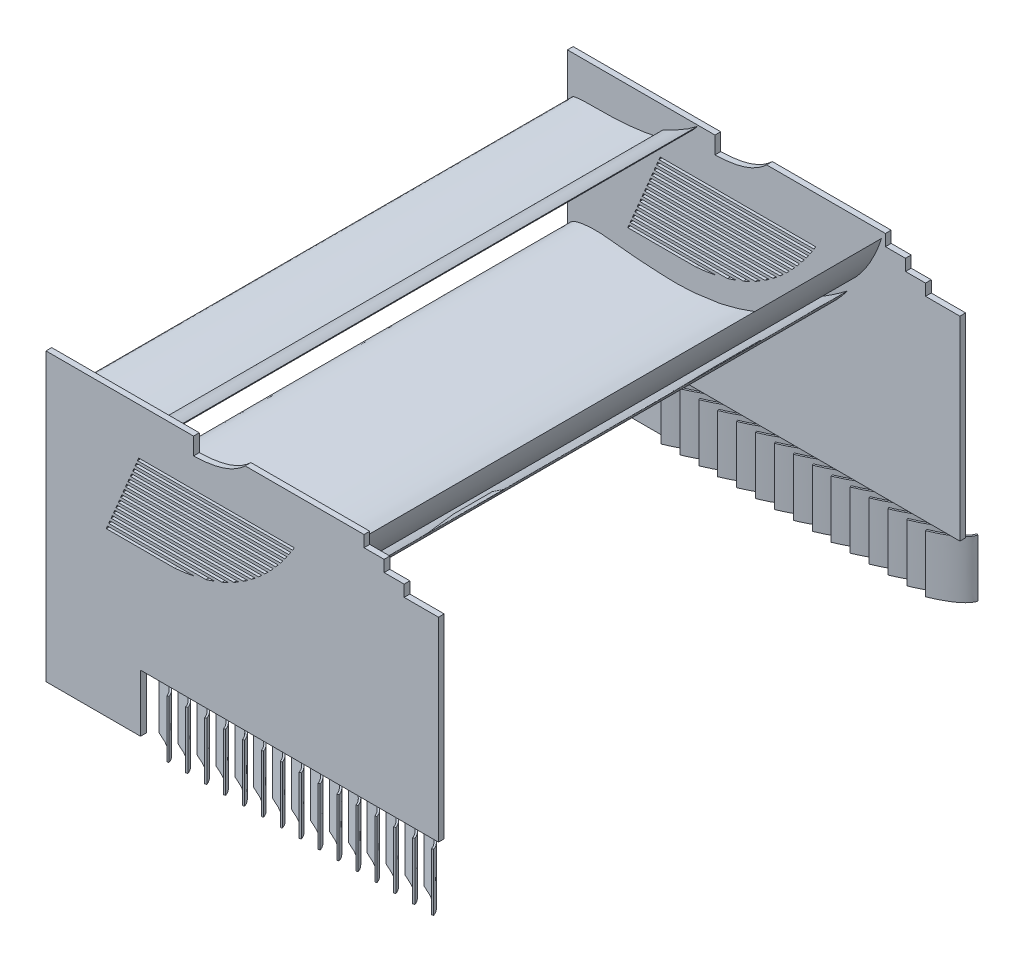
from build123d import *

# Parameters (mm, degrees)
BOSS_EXTRUDE1_DEPTH   = 900
BOSS_EXTRUDE1_2_DEPTH = 900
BOSS_EXTRUDE1_3_DEPTH = 900
BOSS_EXTRUDE2_DEPTH   = 10
BOSS_EXTRUDE3_DEPTH   = 900
CUT_EXTRUDE1_DEPTH    = 900
CUT_EXTRUDE2_DEPTH    = 900
BOSS_EXTRUDE5_DEPTH   = 100


with BuildPart() as part:
    # Sketch2 → Boss-Extrude1 (new body)
    with BuildSketch(Plane.XY):
        with BuildLine():
            add(Edge.make_bspline(
                [(0, 0), (-0.65975565, -5.699703464), (8.017548516, -15.480562025), (19.551157506, -21.724015646), (30.016745353, -25.302215165), (39.859962541, -28.8642232), (50.040399275, -30.662933418), (60.070603806, -32.257702331), (70.013877162, -34.217674322), (80.100972933, -34.55999195), (90.093066457, -35.36519438), (100.111969814, -35.952943269), (110.128217778, -35.507216678), (120.153157744, -35.210003546), (130.150331683, -34.229800116), (140.189993261, -33.410162922), (150.178235204, -31.913406007), (160.170449627, -30.371338734), (170.240789754, -29.163640841), (180.208316099, -27.151030087), (190.263801281, -25.306120223), (200.239152099, -22.872450662), (210.244577583, -20.429111012), (220.232934245, -17.895088966), (230.381125348, -15.705438437), (240.351948949, -12.391144832), (253.551193017, -7.369638816), (266.947574476, -2.806549313), (280.436865809, 1.636643436), (290.361357742, 5.819516769), (300.440735094, 10.032227759), (310.304777653, 14.884053202), (323.821431636, 20.884190166), (337.30228202, 27.249833417), (350.274680503, 34.850235797), (364.037447664, 41.200679435), (378.073354269, 50.431878374), (389.268655411, 56.991671546), (404.933124868, 70.670428585), (388.893146181, 60.897261379), (380.961681237, 56.833339948), (370.316551331, 52.173205743), (360.413556578, 47.749137904), (350.469658047, 43.075442492), (340.496714174, 38.833200032), (330.405194537, 35.260956145), (320.349773519, 31.849438488), (310.358327921, 28.32591748), (300.486931551, 24.662169398), (290.321799777, 22.300639283), (280.290360105, 19.76188557), (270.426731207, 16.765017679), (260.335958512, 15.061341224), (250.276874186, 13.958758108), (240.266180313, 12.578254982), (230.278688892, 11.06786106), (220.28670052, 9.696364143), (210.243264635, 9.240413966), (200.228739037, 9.034505305), (190.217040672, 8.279165066), (180.212460889, 9.162360851), (170.184221628, 8.728504773), (160.186505008, 9.582197967), (150.167787888, 9.989196896), (140.163470123, 10.700746944), (130.145958281, 11.214450998), (120.121382338, 11.840881885), (110.132801048, 12.969737489), (100.114836916, 13.850136605), (90.093770057, 14.715857774), (80.079633724, 15.842660607), (56.917746978, 18.847498868), (32.382831952, 18.963380484), (8.41761673, 12.262874152), (0.546057517, 4.717452477), (0, 0)],
                knots=[0, 0, 0, 0, 0.022023736, 0.035622153, 0.048196888, 0.060584536, 0.072602109, 0.084545422, 0.096478612, 0.108283816, 0.120089627, 0.131879307, 0.143660654, 0.15544949, 0.167268546, 0.17910001, 0.190991158, 0.20289685, 0.214787999, 0.226765538, 0.23876847, 0.250863752, 0.262991876, 0.27512, 0.287234564, 0.299600692, 0.31214973, 0.337081787, 0.34954249, 0.362249466, 0.375072168, 0.388091419, 0.401030286, 0.427260863, 0.440708926, 0.453891579, 0.481343844, 0.495528159, 0.510184265, 0.522427916, 0.535732546, 0.548643086, 0.561553626, 0.574510663, 0.587286643, 0.599816472, 0.612271303, 0.624763182, 0.637218013, 0.649381244, 0.661544475, 0.673750263, 0.685718325, 0.697586388, 0.709471547, 0.721375261, 0.733243324, 0.745039761, 0.756824219, 0.768610895, 0.780397571, 0.792175284, 0.803971722, 0.815766061, 0.82756692, 0.839363385, 0.851169099, 0.863005976, 0.874833225, 0.886659586, 0.898509641, 0.910371212, 0.969295412, 0.981771696, 1, 1, 1, 1], degree=3))
        make_face()
    extrude(amount=BOSS_EXTRUDE1_DEPTH)



with BuildPart() as body_2:
    # Sketch2 → Boss-Extrude1 2 (new body)
    with BuildSketch(Plane.XY):
        with BuildLine():
            add(Edge.make_bspline(
                [(488.73992863, 146.276625829), (488.734390863, 146.282664356), (488.424255517, 146.015046997), (488.06224571, 145.78510435), (487.262468982, 145.126312202), (486.219708703, 144.371292999), (484.873478649, 143.336701677), (483.250678892, 142.116067573), (481.344943871, 140.702556836), (479.183854282, 139.108333078), (476.761259361, 137.364331889), (474.123745832, 135.449437464), (471.236790602, 133.439330858), (468.165688429, 131.291310186), (464.896239769, 129.067635846), (461.457519682, 126.769533617), (457.874048726, 124.410588123), (454.151349507, 122.026984888), (450.329646269, 119.608278587), (446.41836705, 117.19210493), (442.442349173, 114.792641259), (438.43193703, 112.415341988), (434.42114363, 110.058907294), (430.419325782, 107.74839744), (426.469079038, 105.475179612), (422.572434597, 103.270040027), (418.782946314, 101.105445668), (415.103822048, 99.01892845), (411.581105321, 96.980001912), (408.223119368, 95.024650916), (405.070149132, 93.117181313), (402.117764879, 91.312769814), (399.415735867, 89.554324386), (396.965291652, 87.893504979), (394.792388291, 86.318571947), (392.915837215, 84.829964237), (391.349809227, 83.430905822), (390.083467317, 82.150893966), (389.152598068, 80.964624913), (388.566460536, 79.872034746), (388.31048608, 78.86894122), (388.452520239, 77.947544055), (389.013376817, 77.204475769), (389.915554573, 76.684991476), (391.128157446, 76.384212118), (392.650081725, 76.254634507), (394.48507873, 76.313765499), (396.623198675, 76.579439281), (399.045948072, 77.035742523), (401.735792151, 77.720460618), (404.675674285, 78.596752435), (407.839178956, 79.704940552), (411.200777121, 81.026852514), (414.720896472, 82.590974299), (418.395557374, 84.341793332), (422.179917585, 86.309143039), (426.045683707, 88.480043342), (429.970357242, 90.828820323), (433.914957703, 93.364526939), (437.871228384, 96.040204149), (441.793376071, 98.866131635), (445.668479549, 101.797178284), (449.465692449, 104.827226536), (453.167907327, 107.924049831), (456.76145535, 111.053999458), (460.202936902, 114.219487851), (463.519091154, 117.342970547), (466.650128692, 120.455005022), (469.613566921, 123.489837804), (472.370170636, 126.450937081), (474.953957291, 129.265647603), (477.297780382, 131.960513478), (479.456204478, 134.463515761), (481.381106749, 136.784579704), (483.077897662, 138.897364919), (484.557730654, 140.769579134), (485.809879979, 142.38248786), (486.847928071, 143.738913606), (487.625844434, 144.768628828), (488.251100258, 145.595659419), (488.480713959, 145.957078055), (488.74539046, 146.270670107), (488.73992863, 146.276625829)],
                knots=[0, 0, 0, 0, 0.000781199, 0.003073574, 0.006930933, 0.012248071, 0.019030102, 0.027225991, 0.036784991, 0.047610037, 0.059602429, 0.072763906, 0.086896902, 0.102003859, 0.117938515, 0.134556032, 0.151857595, 0.169650659, 0.187837924, 0.206373783, 0.225065344, 0.243814112, 0.262569213, 0.281136751, 0.299513586, 0.317505655, 0.335105223, 0.352118009, 0.368487898, 0.384166869, 0.39895523, 0.412906354, 0.425871787, 0.437810597, 0.448585292, 0.458212857, 0.466668993, 0.473884465, 0.479894259, 0.484778924, 0.488742849, 0.492166792, 0.495627983, 0.499576303, 0.504486665, 0.51057614, 0.517942731, 0.526573967, 0.536524046, 0.547640111, 0.560015283, 0.573490911, 0.58803144, 0.603543533, 0.619911609, 0.637089411, 0.654944026, 0.673346428, 0.692212491, 0.711460838, 0.730910148, 0.750475101, 0.77002178, 0.789460649, 0.808651173, 0.827457923, 0.845819698, 0.863558965, 0.880665567, 0.896944906, 0.912322084, 0.926717772, 0.939992516, 0.952161421, 0.963060032, 0.972661788, 0.980906352, 0.987732879, 0.993080076, 0.996902186, 0.999229514, 1, 1, 1, 1], degree=3))
        make_face()
    extrude(amount=BOSS_EXTRUDE1_2_DEPTH)


with BuildPart() as body_3:
    # Sketch2 → Boss-Extrude1 3 (new body)
    with BuildSketch(Plane.XY):
        with BuildLine():
            add(Edge.make_bspline(
                [(548.142677429, 255.362022493), (548.135374227, 255.365952606), (547.927936153, 255.006923964), (547.658371583, 254.666651265), (547.113002911, 253.770748213), (546.367364831, 252.702005657), (545.424638558, 251.265023805), (544.27941979, 249.558165284), (542.927897021, 247.572779047), (541.392389605, 245.329670238), (539.656724271, 242.856366084), (537.77246287, 240.148181213), (535.681420522, 237.265978202), (533.460225952, 234.1906606), (531.074588655, 230.97702341), (528.551895931, 227.635912658), (525.911068883, 224.188473742), (523.145346923, 220.671136821), (520.29665909, 217.087300279), (517.361495783, 213.476080086), (514.358883712, 209.859293663), (511.316016626, 206.252251869), (508.265842752, 202.665029322), (505.208968651, 199.124696426), (502.1889872, 195.637173296), (499.197596623, 192.232566763), (496.295154414, 188.902374923), (493.472239146, 185.683544867), (490.783011296, 182.562252326), (488.223454385, 179.575667492), (485.843956575, 176.703071592), (483.621924068, 173.995738505), (481.623931594, 171.41564926), (479.833965661, 169.012598811), (478.280745879, 166.784000715), (476.982109533, 164.736533764), (475.9505309, 162.877995089), (475.165835333, 161.232977644), (474.670653437, 159.789198906), (474.473857946, 158.549678558), (474.562913108, 157.505571006), (475.005273255, 156.671993733), (475.788683212, 156.148250847), (476.823995566, 155.951818146), (478.083297743, 156.067751239), (479.581340455, 156.450270824), (481.315884792, 157.117361276), (483.27148496, 158.082761094), (485.435756441, 159.325104089), (487.779363945, 160.874677932), (490.298259918, 162.690587977), (492.953775055, 164.80259248), (495.727550679, 167.184824621), (498.572278285, 169.851349424), (501.502624239, 172.747773867), (504.46579375, 175.887697633), (507.439057803, 179.249297912), (510.409450838, 182.800544998), (513.336696107, 186.537123271), (516.228525151, 190.411393589), (519.037740226, 194.417946242), (521.767005491, 198.509337516), (524.388867963, 202.669455575), (526.897696092, 206.861800297), (529.291618766, 211.049656155), (531.528344155, 215.220888935), (533.659235885, 219.310264722), (535.616969063, 223.327101968), (537.440168258, 227.214370322), (539.090171449, 230.962330487), (540.623673351, 234.512844247), (541.967651222, 237.868945421), (543.198230675, 240.979940777), (544.266104832, 243.839306635), (545.18521028, 246.423662369), (545.97695415, 248.705848341), (546.637316417, 250.664385968), (547.178342468, 252.306492823), (547.579395063, 253.549717004), (547.901947032, 254.548383811), (548.001197383, 254.970292394), (548.149880485, 255.358146272), (548.142677429, 255.362022493)],
                knots=[0, 0, 0, 0, 0.000781199, 0.003073574, 0.006930933, 0.012248071, 0.019030102, 0.027225991, 0.036784991, 0.047610037, 0.059602429, 0.072763906, 0.086896902, 0.102003859, 0.117938515, 0.134556032, 0.151857595, 0.169650659, 0.187837924, 0.206373783, 0.225065344, 0.243814112, 0.262569213, 0.281136751, 0.299513586, 0.317505655, 0.335105223, 0.352118009, 0.368487898, 0.384166869, 0.39895523, 0.412906354, 0.425871787, 0.437810597, 0.448585292, 0.458212857, 0.466668993, 0.473884465, 0.479894259, 0.484778924, 0.488742849, 0.492166792, 0.495627983, 0.499576303, 0.504486665, 0.51057614, 0.517942731, 0.526573967, 0.536524046, 0.547640111, 0.560015283, 0.573490911, 0.58803144, 0.603543533, 0.619911609, 0.637089411, 0.654944026, 0.673346428, 0.692212491, 0.711460838, 0.730910148, 0.750475101, 0.77002178, 0.789460649, 0.808651173, 0.827457923, 0.845819698, 0.863558965, 0.880665567, 0.896944906, 0.912322084, 0.926717772, 0.939992516, 0.952161421, 0.963060032, 0.972661788, 0.980906352, 0.987732879, 0.993080076, 0.996902186, 0.999229514, 1, 1, 1, 1], degree=3))
        make_face()
    extrude(amount=BOSS_EXTRUDE1_3_DEPTH)


with BuildPart() as part_1:
    add(part.part)

    add(body_2.part)  # Boss-Extrude2 merges body 2

    add(body_3.part)  # Boss-Extrude2 merges body 3
    # Sketch5 → Boss-Extrude2 (add)
    with BuildSketch(Plane.XY):
        Polygon((0, 266.2835253), (555.000000941, 266.2835253), (555.000000941, 246.2835253), (590.000000941, 246.2835253), (590.000000941, 226.2835253), (625.000000941, 226.2835253), (625.000000941, 206.2835253), (685.000000941, 206.2835253), (685.000000941, -133.7164747), (165.000000941, -133.7164747), (165.000000941, -233.7164747), (0, -233.7164747), (0, 0), align=None)
    boss_extrude2 = extrude(amount=-BOSS_EXTRUDE2_DEPTH)

    # Sketch6 → Boss-Extrude3 (add)
    with BuildSketch(Plane.XY):
        with BuildLine():
            Line((164.613779142, 214.976136412), (164.723820378, 214.664469851))
            add(Edge.make_bspline(
                [(164.723820378, 214.664469851), (164.648520792, 214.62785328), (164.34784185, 214.481639572), (163.6724355, 214.155247545), (162.549996952, 213.617503095), (160.985188719, 212.878254816), (158.984976969, 211.950245078), (156.558091459, 210.85008651), (153.715646415, 209.596574891), (150.470623362, 208.21147628), (146.838789716, 206.717746076), (142.837921693, 205.140231242), (138.488175426, 203.504962048), (133.812181859, 201.837638924), (128.834692226, 200.164989269), (123.582914289, 198.512714614), (118.086213642, 196.905948015), (112.376209789, 195.368272822), (106.486191905, 193.922834665), (100.451747873, 192.589384758), (94.309682922, 191.38731623), (88.098789404, 190.332048871), (81.858862431, 189.437445075), (75.630944666, 188.713169975), (69.456595048, 188.167141909), (63.377832973, 187.802732102), (57.436667454, 187.619920942), (51.674457693, 187.615799885), (46.131746943, 187.783455241), (40.847534236, 188.112237796), (35.858963346, 188.588868306), (31.20097477, 189.198026011), (26.905404603, 189.920290668), (23.001348407, 190.736844339), (19.514136341, 191.626300897), (16.465607968, 192.567963312), (13.873059459, 193.541178882), (11.74976335, 194.527328758), (10.100256038, 195.510564925), (8.925718365, 196.483778626), (8.206176783, 197.466132507), (8.02697547, 198.508882414), (8.470227148, 199.467441428), (9.409476098, 200.23160778), (10.773566742, 200.880043737), (12.581737712, 201.435839127), (14.827891197, 201.90662304), (17.501946446, 202.294971106), (20.58639208, 202.606885827), (24.061416159, 202.847331482), (27.90441349, 203.025263473), (32.091168331, 203.149306121), (36.595944484, 203.230963582), (41.391766004, 203.282006476), (46.450521964, 203.315413628), (51.743070657, 203.344475349), (57.239340133, 203.383502231), (62.908274903, 203.445583094), (68.717937055, 203.543500979), (74.635487392, 203.689136944), (80.627254443, 203.892101324), (86.658821204, 204.160206649), (92.695207803, 204.498909479), (98.701000079, 204.910411263), (104.640477999, 205.395096222), (110.477863333, 205.94945889), (116.177758049, 206.567602145), (121.705063984, 207.24121294), (127.025524467, 207.95920193), (132.10555678, 208.709379121), (136.913134386, 209.476904936), (141.417305129, 210.247217657), (145.589030953, 211.004246644), (149.400935644, 211.732409722), (152.827876226, 212.416494827), (155.846829262, 213.041879937), (158.437432591, 213.595225115), (160.581893041, 214.064998422), (162.265605107, 214.441007828), (163.476700085, 214.71550428), (164.206793843, 214.882591132), (164.532232533, 214.957392982), (164.613779142, 214.976136412)],
                knots=[0, 0, 0, 0, 0.000779512, 0.003112672, 0.006983595, 0.012366453, 0.01922443, 0.027511488, 0.037172952, 0.048145315, 0.060357993, 0.073731396, 0.088181725, 0.103618331, 0.119946063, 0.137064586, 0.154870456, 0.17325674, 0.192112831, 0.211327336, 0.230785914, 0.250372996, 0.269971687, 0.289465461, 0.308737124, 0.32767029, 0.346151173, 0.364066139, 0.381306847, 0.39776766, 0.413347451, 0.427951846, 0.441492525, 0.453889871, 0.465073667, 0.474985038, 0.483580064, 0.490834634, 0.496756017, 0.501407245, 0.504968517, 0.50787306, 0.510776977, 0.514326794, 0.518938798, 0.524777979, 0.531895445, 0.540287366, 0.549922226, 0.560751286, 0.572712462, 0.585735823, 0.599744882, 0.61465722, 0.63038614, 0.646841751, 0.663930407, 0.681556403, 0.699621216, 0.718024312, 0.736663476, 0.755434295, 0.774231121, 0.792947914, 0.811476445, 0.829708517, 0.847535554, 0.86485073, 0.881545736, 0.89751548, 0.912656405, 0.926869016, 0.94005631, 0.952127904, 0.962998201, 0.972589475, 0.980830171, 0.987660039, 0.993027268, 0.996891237, 0.999221024, 1, 1, 1, 1], degree=3))
        make_face()
        with BuildLine():
            Line((227.014165374, 264.226922408), (227.124498683, 264.117683735))
            add(Edge.make_bspline(
                [(227.124498683, 264.117683735), (227.100159849, 264.086786218), (227.002972401, 263.963409277), (226.784244674, 263.687135237), (226.419789721, 263.229980722), (225.90956242, 262.59706416), (225.25389914, 261.795199069), (224.453089487, 260.833196326), (223.507984217, 259.721278001), (222.419615428, 258.471304258), (221.18994955, 257.09620847), (219.821415035, 255.610135011), (218.317204263, 254.028215794), (216.681623457, 252.365949967), (214.919665011, 250.639704962), (213.037569937, 248.865917434), (211.042607934, 247.061225478), (208.943318901, 245.242073454), (206.749038269, 243.425062503), (204.470768289, 241.625829285), (202.120099201, 239.8601083), (199.710274859, 238.142361018), (197.255281925, 236.486595763), (194.770493839, 234.905301737), (192.271859948, 233.410335323), (189.776455231, 232.011724723), (187.302044509, 230.718062416), (184.866709335, 229.536586443), (182.489006296, 228.472674472), (180.187603898, 227.52980869), (177.980924736, 226.709979502), (175.886877861, 226.013863102), (173.922899143, 225.439766898), (172.105142481, 224.985691856), (170.448695615, 224.647782235), (168.967029431, 224.421758982), (167.671684859, 224.302431588), (166.572085289, 224.284645643), (165.673393307, 224.362629601), (164.977563579, 224.533619745), (164.472228287, 224.801628451), (164.182975782, 225.205799004), (164.174124327, 225.701813604), (164.414772581, 226.217190457), (164.858731971, 226.770618702), (165.509408986, 227.375799229), (166.362663608, 228.034709064), (167.413706516, 228.746373252), (168.653905221, 229.509744345), (170.073867156, 230.322864947), (171.662201674, 231.184893168), (173.406905, 232.094517404), (175.294740921, 233.051332311), (177.311894526, 234.054791381), (179.443823684, 235.104626545), (181.675486694, 236.200490389), (183.991239673, 237.342276403), (186.375273051, 238.529160164), (188.811466791, 239.760007307), (191.28350447, 241.033117593), (193.775182692, 242.345660362), (196.270350938, 243.693892226), (198.753103068, 245.072958488), (201.208015771, 246.476539327), (203.619908469, 247.897483995), (205.974372342, 249.326985329), (208.257648968, 250.755302848), (210.456601334, 252.171736048), (212.559016607, 253.564582929), (214.553192236, 254.921814136), (216.428626064, 256.230598714), (218.17521328, 257.47844315), (219.783967257, 258.652607865), (221.246503967, 259.740900035), (222.555307784, 260.731740538), (223.703638392, 261.614233662), (224.685618133, 262.378570601), (225.496085319, 263.016232908), (226.130951632, 263.519921264), (226.586785668, 263.883929527), (226.861249996, 264.104048143), (226.983526109, 264.202302404), (227.014165374, 264.226922408)],
                knots=[0, 0, 0, 0, 0.000779512, 0.003112672, 0.006983595, 0.012366453, 0.01922443, 0.027511488, 0.037172952, 0.048145315, 0.060357993, 0.073731396, 0.088181725, 0.103618331, 0.119946063, 0.137064586, 0.154870456, 0.17325674, 0.192112831, 0.211327336, 0.230785914, 0.250372996, 0.269971687, 0.289465461, 0.308737124, 0.32767029, 0.346151173, 0.364066139, 0.381306847, 0.39776766, 0.413347451, 0.427951846, 0.441492525, 0.453889871, 0.465073667, 0.474985038, 0.483580064, 0.490834634, 0.496756017, 0.501407245, 0.504968517, 0.50787306, 0.510776977, 0.514326794, 0.518938798, 0.524777979, 0.531895445, 0.540287366, 0.549922226, 0.560751286, 0.572712462, 0.585735823, 0.599744882, 0.61465722, 0.63038614, 0.646841751, 0.663930407, 0.681556403, 0.699621216, 0.718024312, 0.736663476, 0.755434295, 0.774231121, 0.792947914, 0.811476445, 0.829708517, 0.847535554, 0.86485073, 0.881545736, 0.89751548, 0.912656405, 0.926869016, 0.94005631, 0.952127904, 0.962998201, 0.972589475, 0.980830171, 0.987660039, 0.993027268, 0.996891237, 0.999221024, 1, 1, 1, 1], degree=3))
        make_face()
    extrude(amount=BOSS_EXTRUDE3_DEPTH)

    # Sketch7 → Cut-Extrude1 (cut)
    with BuildSketch(Plane.XY):
        with BuildLine():
            Line((257.530092853, 266.2835253), (257.530092853, 236.2835253))
            add(Edge.make_bspline(
                [(347.530092853, 266.2835253), (317.571378056, 237.21102108), (257.530092853, 236.2835253)],
                knots=[0, 0, 0, 1, 1, 1], degree=2))
            Line((347.530092853, 266.2835253), (257.530092853, 266.2835253))
        make_face()
    cut_extrude1 = extrude(amount=-CUT_EXTRUDE1_DEPTH, mode=Mode.SUBTRACT)

    # Sketch8 → Cut-Extrude2 (cut)
    with BuildSketch(Plane.XY):
        with BuildLine():
            Line((161.803662931, 185.278358624), (433.527522538, 185.278358624))
            add(Edge.make_bspline(
                [(433.527522538, 185.278358624), (431.986033483, 182.754958382), (430.420792306, 180.278358625)],
                knots=[0, 0, 0, 0.017044084, 0.017044084, 0.017044084], degree=2))
            Line((430.420792306, 180.278358625), (159.708601591, 180.278358625))
            Line((159.708601591, 180.278358625), (161.803662931, 185.278358624))
        make_face()
        with BuildLine():
            Line((155.51847891, 170.278358624), (423.874587116, 170.278358624))
            add(Edge.make_bspline(
                [(427.205326309, 175.278358623), (426.103638199, 173.59482896), (424.993391797, 171.928162297), (423.874587116, 170.278358624)],
                knots=[0.034416516, 0.034416516, 0.034416516, 0.034416516, 0.052137037, 0.052137037, 0.052137037, 0.052137037], degree=3))
            Line((427.205326309, 175.278358623), (157.61354025, 175.278358623))
            Line((157.61354025, 175.278358623), (155.51847891, 170.278358624))
        make_face()
        with BuildLine():
            Line((151.328356229, 160.278358623), (416.837622605, 160.278358623))
            add(Edge.make_bspline(
                [(420.421354783, 165.278358623), (419.236089505, 163.593343639), (418.041512112, 161.926676973), (416.837622605, 160.278358623)],
                knots=[0.070227449, 0.070227449, 0.070227449, 0.070227449, 0.088711929, 0.088711929, 0.088711929, 0.088711929], degree=3))
            Line((420.421354783, 165.278358623), (153.42341757, 165.278358623))
            Line((153.42341757, 165.278358623), (151.328356229, 160.278358623))
        make_face()
        with BuildLine():
            Line((147.138233549, 150.278358623), (409.241918291, 150.278358623))
            add(Edge.make_bspline(
                [(413.114471658, 155.278358622), (411.833832124, 153.591571342), (410.542981002, 151.924904676), (409.241918291, 150.278358623)],
                knots=[0.107617411, 0.107617411, 0.107617411, 0.107617411, 0.12697404, 0.12697404, 0.12697404, 0.12697404], degree=3))
            Line((413.114471658, 155.278358622), (149.233294889, 155.278358622))
            Line((149.233294889, 155.278358622), (147.138233549, 150.278358623))
        make_face()
        with BuildLine():
            Line((142.948110868, 140.278358622), (401.00217999, 140.278358622))
            add(Edge.make_bspline(
                [(405.208727185, 145.278358621), (403.817848225, 143.589419991), (402.415665827, 141.922753326), (401.00217999, 140.278358622)],
                knots=[0.146815745, 0.146815745, 0.146815745, 0.146815745, 0.167180931, 0.167180931, 0.167180931, 0.167180931], degree=3))
            Line((405.208727185, 145.278358621), (145.043172208, 145.278358621))
            Line((145.043172208, 145.278358621), (142.948110868, 140.278358622))
        make_face()
        with BuildLine():
            Line((138.757988187, 130.278358621), (392.008915127, 130.278358621))
            add(Edge.make_bspline(
                [(396.607785875, 135.278358621), (395.087485747, 133.586753391), (393.554528832, 131.920086723), (392.008915127, 130.278358621)],
                knots=[0.188113355, 0.188113355, 0.188113355, 0.188113355, 0.209663235, 0.209663235, 0.209663235, 0.209663235], degree=3))
            Line((396.607785875, 135.278358621), (140.853049527, 135.278358621))
            Line((140.853049527, 135.278358621), (138.757988187, 130.278358621))
        make_face()
        with BuildLine():
            Line((134.567865506, 120.278358621), (382.117568981, 120.278358621))
            add(Edge.make_bspline(
                [(387.186329186, 125.27835862), (385.511120845, 123.583361188), (383.821534109, 121.916694525), (382.117568981, 120.278358621)],
                knots=[0.231888664, 0.231888664, 0.231888664, 0.231888664, 0.254857463, 0.254857463, 0.254857463, 0.254857463], degree=3))
            Line((387.186329186, 125.27835862), (136.662926846, 125.27835862))
            Line((136.662926846, 125.27835862), (134.567865506, 120.278358621))
        make_face()
        with BuildLine():
            Line((130.377742825, 110.27835862), (371.130448262, 110.27835862))
            add(Edge.make_bspline(
                [(376.776145493, 115.278358619), (374.910888715, 113.578900458), (373.028989635, 111.912233792), (371.130448262, 110.27835862)],
                knots=[0.278649618, 0.278649618, 0.278649618, 0.278649618, 0.303360585, 0.303360585, 0.303360585, 0.303360585], degree=3))
            Line((376.776145493, 115.278358619), (132.472804165, 115.278358619))
            Line((132.472804165, 115.278358619), (130.377742825, 110.27835862))
        make_face()
        with BuildLine():
            Line((126.187620144, 100.278358619), (358.764540814, 100.278358619))
            add(Edge.make_bspline(
                [(365.142241667, 105.278358619), (363.036094183, 103.572771614), (360.9101939, 101.906104944), (358.764540814, 100.278358619)],
                knots=[0.329105822, 0.329105822, 0.329105822, 0.329105822, 0.35602721, 0.35602721, 0.35602721, 0.35602721], degree=3))
            Line((365.142241667, 105.278358619), (128.282681484, 105.278358619))
            Line((128.282681484, 105.278358619), (126.187620144, 100.278358619))
        make_face()
        with BuildLine():
            Line((121.997497463, 90.278358619), (344.58887312, 90.278358619))
            add(Edge.make_bspline(
                [(351.938522321, 95.278358618), (349.512933739, 93.563822812), (347.063050674, 91.897156142), (344.58887312, 90.278358619)],
                knots=[0.384302376, 0.384302376, 0.384302376, 0.384302376, 0.414158742, 0.414158742, 0.414158742, 0.414158742], degree=3))
            Line((351.938522321, 95.278358618), (124.092558803, 95.278358618))
            Line((124.092558803, 95.278358618), (121.997497463, 90.278358619))
        make_face()
        with BuildLine():
            Line((117.807374782, 80.278358618), (327.886387735, 80.278358618))
            add(Edge.make_bspline(
                [(336.616487009, 85.278358617), (333.738005948, 83.549522756), (330.827972857, 81.882856089), (327.886387735, 80.278358618)],
                knots=[0.445895578, 0.445895578, 0.445895578, 0.445895578, 0.47992047, 0.47992047, 0.47992047, 0.47992047], degree=3))
            Line((336.616487009, 85.278358617), (119.902436122, 85.278358617))
            Line((119.902436122, 85.278358617), (117.807374782, 80.278358618))
        make_face()
        with BuildLine():
            Line((113.617252101, 70.278358617), (307.286080617, 70.278358617))
            add(Edge.make_bspline(
                [(318.206400634, 75.278358617), (314.611304353, 73.523004798), (310.97119768, 71.856338132), (307.286080617, 70.278358617)],
                knots=[0.516813724, 0.516813724, 0.516813724, 0.516813724, 0.557452394, 0.557452394, 0.557452394, 0.557452394], degree=3))
            Line((318.206400634, 75.278358617), (115.712313441, 75.278358617))
            Line((115.712313441, 75.278358617), (113.617252101, 70.278358617))
        make_face()
        with BuildLine():
            Line((109.42712942, 60.278358617), (279.393756019, 60.278358617))
            add(Edge.make_bspline(
                [(294.647543822, 65.278358616), (289.641612, 63.456694494), (284.557016067, 61.790027823), (279.393756019, 60.278358617)],
                knots=[0.603279538, 0.603279538, 0.603279538, 0.603279538, 0.657003919, 0.657003919, 0.657003919, 0.657003919], degree=3))
            Line((294.647543822, 65.278358616), (111.52219076, 65.278358616))
            Line((111.52219076, 65.278358616), (109.42712942, 60.278358617))
        make_face()
        with BuildLine():
            Line((105.237006739, 50.278358616), (224.538691684, 50.278358616))
            add(Edge.make_bspline(
                [(259.386529007, 55.278358615), (248.117929064, 52.927291927), (236.50198329, 51.260625257), (224.538691684, 50.278358616)],
                knots=[0.725082192, 0.725082192, 0.725082192, 0.725082192, 0.837974445, 0.837974445, 0.837974445, 0.837974445], degree=3))
            Line((259.386529007, 55.278358615), (107.332068079, 55.278358615))
            Line((107.332068079, 55.278358615), (105.237006739, 50.278358616))
        make_face()
    cut_extrude2 = extrude(amount=-CUT_EXTRUDE2_DEPTH, mode=Mode.SUBTRACT)

    # Sketch18 → Boss-Extrude5 (add)
    with BuildSketch(Plane.XZ.offset(133.7164747)):
        with BuildLine():
            Line((210.387668134, 14.050123329), (209.244660734, 11.276401266))
            add(Edge.make_bspline(
                [(209.244660734, 11.276401266), (210.187078035, 10.888045863), (212.08433135, 10.094905215), (215.73139516, 8.524199916), (220.1043215, 6.5528454), (225.025319607, 4.186980954), (231.160508566, 1.029366896), (238.024038159, -2.918699284), (244.966874005, -7.644875057), (250.611324162, -12.338208085), (254.234177909, -16.194558985), (256.495320449, -19.228388893), (257.877596186, -21.469365831), (258.959830034, -23.690783728), (259.475508082, -25.115792553), (259.695922395, -25.856082073)],
                knots=[0, 0, 0, 0, 0.03125, 0.0625, 0.125, 0.1875, 0.25, 0.375, 0.5, 0.625, 0.75, 0.8125, 0.875, 0.9375, 1, 1, 1, 1], degree=3))
            Line((259.695922395, -25.856082073), (262.571182989, -25))
            add(Edge.make_bspline(
                [(210.387668134, 14.050123329), (256.616369188, -5), (262.571182989, -25)],
                knots=[0, 0, 0, 1, 1, 1], degree=2))
        make_face()
        with BuildLine():
            Line((177.387668134, 14.050123329), (176.244660734, 11.276401266))
            add(Edge.make_bspline(
                [(176.244660734, 11.276401266), (177.187078035, 10.888045863), (179.08433135, 10.094905215), (182.73139516, 8.524199916), (187.1043215, 6.5528454), (192.025319607, 4.186980954), (198.160508566, 1.029366896), (205.024038159, -2.918699284), (211.966874005, -7.644875057), (217.611324162, -12.338208085), (221.234177909, -16.194558985), (223.495320449, -19.228388893), (224.877596186, -21.469365831), (225.959830034, -23.690783728), (226.475508082, -25.115792553), (226.695922395, -25.856082073)],
                knots=[0, 0, 0, 0, 0.03125, 0.0625, 0.125, 0.1875, 0.25, 0.375, 0.5, 0.625, 0.75, 0.8125, 0.875, 0.9375, 1, 1, 1, 1], degree=3))
            Line((226.695922395, -25.856082073), (229.571182989, -25))
            add(Edge.make_bspline(
                [(177.387668134, 14.050123329), (223.616369188, -5), (229.571182989, -25)],
                knots=[0, 0, 0, 1, 1, 1], degree=2))
        make_face()
        with BuildLine():
            Line((243.387668134, 14.050123329), (242.244660734, 11.276401266))
            add(Edge.make_bspline(
                [(242.244660734, 11.276401266), (243.187078035, 10.888045863), (245.08433135, 10.094905215), (248.73139516, 8.524199916), (253.1043215, 6.5528454), (258.025319607, 4.186980954), (264.160508566, 1.029366896), (271.024038159, -2.918699284), (277.966874005, -7.644875057), (283.611324162, -12.338208085), (287.234177909, -16.194558985), (289.495320449, -19.228388893), (290.877596186, -21.469365831), (291.959830034, -23.690783728), (292.475508082, -25.115792553), (292.695922395, -25.856082073)],
                knots=[0, 0, 0, 0, 0.03125, 0.0625, 0.125, 0.1875, 0.25, 0.375, 0.5, 0.625, 0.75, 0.8125, 0.875, 0.9375, 1, 1, 1, 1], degree=3))
            Line((292.695922395, -25.856082073), (295.571182989, -25))
            add(Edge.make_bspline(
                [(243.387668134, 14.050123329), (289.616369188, -5), (295.571182989, -25)],
                knots=[0, 0, 0, 1, 1, 1], degree=2))
        make_face()
        with BuildLine():
            Line((276.387668134, 14.050123329), (275.244660734, 11.276401266))
            add(Edge.make_bspline(
                [(275.244660734, 11.276401266), (276.187078035, 10.888045863), (278.08433135, 10.094905215), (281.73139516, 8.524199916), (286.1043215, 6.5528454), (291.025319607, 4.186980954), (297.160508566, 1.029366896), (304.024038159, -2.918699284), (310.966874005, -7.644875057), (316.611324162, -12.338208085), (320.234177909, -16.194558985), (322.495320449, -19.228388893), (323.877596186, -21.469365831), (324.959830034, -23.690783728), (325.475508082, -25.115792553), (325.695922395, -25.856082073)],
                knots=[0, 0, 0, 0, 0.03125, 0.0625, 0.125, 0.1875, 0.25, 0.375, 0.5, 0.625, 0.75, 0.8125, 0.875, 0.9375, 1, 1, 1, 1], degree=3))
            Line((325.695922395, -25.856082073), (328.571182989, -25))
            add(Edge.make_bspline(
                [(276.387668134, 14.050123329), (322.616369188, -5), (328.571182989, -25)],
                knots=[0, 0, 0, 1, 1, 1], degree=2))
        make_face()
        with BuildLine():
            Line((309.387668134, 14.050123329), (308.244660734, 11.276401266))
            add(Edge.make_bspline(
                [(308.244660734, 11.276401266), (309.187078035, 10.888045863), (311.08433135, 10.094905215), (314.73139516, 8.524199916), (319.1043215, 6.5528454), (324.025319607, 4.186980954), (330.160508566, 1.029366896), (337.024038159, -2.918699284), (343.966874005, -7.644875057), (349.611324162, -12.338208085), (353.234177909, -16.194558985), (355.495320449, -19.228388893), (356.877596186, -21.469365831), (357.959830034, -23.690783728), (358.475508082, -25.115792553), (358.695922395, -25.856082073)],
                knots=[0, 0, 0, 0, 0.03125, 0.0625, 0.125, 0.1875, 0.25, 0.375, 0.5, 0.625, 0.75, 0.8125, 0.875, 0.9375, 1, 1, 1, 1], degree=3))
            Line((358.695922395, -25.856082073), (361.571182989, -25))
            add(Edge.make_bspline(
                [(309.387668134, 14.050123329), (355.616369188, -5), (361.571182989, -25)],
                knots=[0, 0, 0, 1, 1, 1], degree=2))
        make_face()
        with BuildLine():
            Line((342.387668134, 14.050123329), (341.244660734, 11.276401266))
            add(Edge.make_bspline(
                [(341.244660734, 11.276401266), (342.187078035, 10.888045863), (344.08433135, 10.094905215), (347.73139516, 8.524199916), (352.1043215, 6.5528454), (357.025319607, 4.186980954), (363.160508566, 1.029366896), (370.024038159, -2.918699284), (376.966874005, -7.644875057), (382.611324162, -12.338208085), (386.234177909, -16.194558985), (388.495320449, -19.228388893), (389.877596186, -21.469365831), (390.959830034, -23.690783728), (391.475508082, -25.115792553), (391.695922395, -25.856082073)],
                knots=[0, 0, 0, 0, 0.03125, 0.0625, 0.125, 0.1875, 0.25, 0.375, 0.5, 0.625, 0.75, 0.8125, 0.875, 0.9375, 1, 1, 1, 1], degree=3))
            Line((391.695922395, -25.856082073), (394.571182989, -25))
            add(Edge.make_bspline(
                [(342.387668134, 14.050123329), (388.616369188, -5), (394.571182989, -25)],
                knots=[0, 0, 0, 1, 1, 1], degree=2))
        make_face()
        with BuildLine():
            Line((375.387668134, 14.050123329), (374.244660734, 11.276401266))
            add(Edge.make_bspline(
                [(374.244660734, 11.276401266), (375.187078035, 10.888045863), (377.08433135, 10.094905215), (380.73139516, 8.524199916), (385.1043215, 6.5528454), (390.025319607, 4.186980954), (396.160508566, 1.029366896), (403.024038159, -2.918699284), (409.966874005, -7.644875057), (415.611324162, -12.338208085), (419.234177909, -16.194558985), (421.495320449, -19.228388893), (422.877596186, -21.469365831), (423.959830034, -23.690783728), (424.475508082, -25.115792553), (424.695922395, -25.856082073)],
                knots=[0, 0, 0, 0, 0.03125, 0.0625, 0.125, 0.1875, 0.25, 0.375, 0.5, 0.625, 0.75, 0.8125, 0.875, 0.9375, 1, 1, 1, 1], degree=3))
            Line((424.695922395, -25.856082073), (427.571182989, -25))
            add(Edge.make_bspline(
                [(375.387668134, 14.050123329), (421.616369188, -5), (427.571182989, -25)],
                knots=[0, 0, 0, 1, 1, 1], degree=2))
        make_face()
        with BuildLine():
            Line((408.387668134, 14.050123329), (407.244660734, 11.276401266))
            add(Edge.make_bspline(
                [(407.244660734, 11.276401266), (408.187078035, 10.888045863), (410.08433135, 10.094905215), (413.73139516, 8.524199916), (418.1043215, 6.5528454), (423.025319607, 4.186980954), (429.160508566, 1.029366896), (436.024038159, -2.918699284), (442.966874005, -7.644875057), (448.611324162, -12.338208085), (452.234177909, -16.194558985), (454.495320449, -19.228388893), (455.877596186, -21.469365831), (456.959830034, -23.690783728), (457.475508082, -25.115792553), (457.695922395, -25.856082073)],
                knots=[0, 0, 0, 0, 0.03125, 0.0625, 0.125, 0.1875, 0.25, 0.375, 0.5, 0.625, 0.75, 0.8125, 0.875, 0.9375, 1, 1, 1, 1], degree=3))
            Line((457.695922395, -25.856082073), (460.571182989, -25))
            add(Edge.make_bspline(
                [(408.387668134, 14.050123329), (454.616369188, -5), (460.571182989, -25)],
                knots=[0, 0, 0, 1, 1, 1], degree=2))
        make_face()
        with BuildLine():
            Line((441.387668134, 14.050123329), (440.244660734, 11.276401266))
            add(Edge.make_bspline(
                [(440.244660734, 11.276401266), (441.187078035, 10.888045863), (443.08433135, 10.094905215), (446.73139516, 8.524199916), (451.1043215, 6.5528454), (456.025319607, 4.186980954), (462.160508566, 1.029366896), (469.024038159, -2.918699284), (475.966874005, -7.644875057), (481.611324162, -12.338208085), (485.234177909, -16.194558985), (487.495320449, -19.228388893), (488.877596186, -21.469365831), (489.959830034, -23.690783728), (490.475508082, -25.115792553), (490.695922395, -25.856082073)],
                knots=[0, 0, 0, 0, 0.03125, 0.0625, 0.125, 0.1875, 0.25, 0.375, 0.5, 0.625, 0.75, 0.8125, 0.875, 0.9375, 1, 1, 1, 1], degree=3))
            Line((490.695922395, -25.856082073), (493.571182989, -25))
            add(Edge.make_bspline(
                [(441.387668134, 14.050123329), (487.616369188, -5), (493.571182989, -25)],
                knots=[0, 0, 0, 1, 1, 1], degree=2))
        make_face()
        with BuildLine():
            Line((474.387668134, 14.050123329), (473.244660734, 11.276401266))
            add(Edge.make_bspline(
                [(473.244660734, 11.276401266), (474.187078035, 10.888045863), (476.08433135, 10.094905215), (479.73139516, 8.524199916), (484.1043215, 6.5528454), (489.025319607, 4.186980954), (495.160508566, 1.029366896), (502.024038159, -2.918699284), (508.966874005, -7.644875057), (514.611324162, -12.338208085), (518.234177909, -16.194558985), (520.495320449, -19.228388893), (521.877596186, -21.469365831), (522.959830034, -23.690783728), (523.475508082, -25.115792553), (523.695922395, -25.856082073)],
                knots=[0, 0, 0, 0, 0.03125, 0.0625, 0.125, 0.1875, 0.25, 0.375, 0.5, 0.625, 0.75, 0.8125, 0.875, 0.9375, 1, 1, 1, 1], degree=3))
            Line((523.695922395, -25.856082073), (526.571182989, -25))
            add(Edge.make_bspline(
                [(474.387668134, 14.050123329), (520.616369188, -5), (526.571182989, -25)],
                knots=[0, 0, 0, 1, 1, 1], degree=2))
        make_face()
        with BuildLine():
            Line((507.387668134, 14.050123329), (506.244660734, 11.276401266))
            add(Edge.make_bspline(
                [(506.244660734, 11.276401266), (507.187078035, 10.888045863), (509.08433135, 10.094905215), (512.73139516, 8.524199916), (517.1043215, 6.5528454), (522.025319607, 4.186980954), (528.160508566, 1.029366896), (535.024038159, -2.918699284), (541.966874005, -7.644875057), (547.611324162, -12.338208085), (551.234177909, -16.194558985), (553.495320449, -19.228388893), (554.877596186, -21.469365831), (555.959830034, -23.690783728), (556.475508082, -25.115792553), (556.695922395, -25.856082073)],
                knots=[0, 0, 0, 0, 0.03125, 0.0625, 0.125, 0.1875, 0.25, 0.375, 0.5, 0.625, 0.75, 0.8125, 0.875, 0.9375, 1, 1, 1, 1], degree=3))
            Line((556.695922395, -25.856082073), (559.571182989, -25))
            add(Edge.make_bspline(
                [(507.387668134, 14.050123329), (553.616369188, -5), (559.571182989, -25)],
                knots=[0, 0, 0, 1, 1, 1], degree=2))
        make_face()
        with BuildLine():
            Line((540.387668134, 14.050123329), (539.244660734, 11.276401266))
            add(Edge.make_bspline(
                [(539.244660734, 11.276401266), (540.187078035, 10.888045863), (542.08433135, 10.094905215), (545.73139516, 8.524199916), (550.1043215, 6.5528454), (555.025319607, 4.186980954), (561.160508566, 1.029366896), (568.024038159, -2.918699284), (574.966874005, -7.644875057), (580.611324162, -12.338208085), (584.234177909, -16.194558985), (586.495320449, -19.228388893), (587.877596186, -21.469365831), (588.959830034, -23.690783728), (589.475508082, -25.115792553), (589.695922395, -25.856082073)],
                knots=[0, 0, 0, 0, 0.03125, 0.0625, 0.125, 0.1875, 0.25, 0.375, 0.5, 0.625, 0.75, 0.8125, 0.875, 0.9375, 1, 1, 1, 1], degree=3))
            Line((589.695922395, -25.856082073), (592.571182989, -25))
            add(Edge.make_bspline(
                [(540.387668134, 14.050123329), (586.616369188, -5), (592.571182989, -25)],
                knots=[0, 0, 0, 1, 1, 1], degree=2))
        make_face()
        with BuildLine():
            Line((573.387668134, 14.050123329), (572.244660734, 11.276401266))
            add(Edge.make_bspline(
                [(572.244660734, 11.276401266), (573.187078035, 10.888045863), (575.08433135, 10.094905215), (578.73139516, 8.524199916), (583.1043215, 6.5528454), (588.025319607, 4.186980954), (594.160508566, 1.029366896), (601.024038159, -2.918699284), (607.966874005, -7.644875057), (613.611324162, -12.338208085), (617.234177909, -16.194558985), (619.495320449, -19.228388893), (620.877596186, -21.469365831), (621.959830034, -23.690783728), (622.475508082, -25.115792553), (622.695922395, -25.856082073)],
                knots=[0, 0, 0, 0, 0.03125, 0.0625, 0.125, 0.1875, 0.25, 0.375, 0.5, 0.625, 0.75, 0.8125, 0.875, 0.9375, 1, 1, 1, 1], degree=3))
            Line((622.695922395, -25.856082073), (625.571182989, -25))
            add(Edge.make_bspline(
                [(573.387668134, 14.050123329), (619.616369188, -5), (625.571182989, -25)],
                knots=[0, 0, 0, 1, 1, 1], degree=2))
        make_face()
        with BuildLine():
            Line((606.387668134, 14.050123329), (605.244660734, 11.276401266))
            add(Edge.make_bspline(
                [(605.244660734, 11.276401266), (606.187078035, 10.888045863), (608.08433135, 10.094905215), (611.73139516, 8.524199916), (616.1043215, 6.5528454), (621.025319607, 4.186980954), (627.160508566, 1.029366896), (634.024038159, -2.918699284), (640.966874005, -7.644875057), (646.611324162, -12.338208085), (650.234177909, -16.194558985), (652.495320449, -19.228388893), (653.877596186, -21.469365831), (654.959830034, -23.690783728), (655.475508082, -25.115792553), (655.695922395, -25.856082073)],
                knots=[0, 0, 0, 0, 0.03125, 0.0625, 0.125, 0.1875, 0.25, 0.375, 0.5, 0.625, 0.75, 0.8125, 0.875, 0.9375, 1, 1, 1, 1], degree=3))
            Line((655.695922395, -25.856082073), (658.571182989, -25))
            add(Edge.make_bspline(
                [(606.387668134, 14.050123329), (652.616369188, -5), (658.571182989, -25)],
                knots=[0, 0, 0, 1, 1, 1], degree=2))
        make_face()
        with BuildLine():
            Line((639.387668134, 14.050123329), (638.244660734, 11.276401266))
            add(Edge.make_bspline(
                [(638.244660734, 11.276401266), (639.187078035, 10.888045863), (641.08433135, 10.094905215), (644.73139516, 8.524199916), (649.1043215, 6.5528454), (654.025319607, 4.186980954), (660.160508566, 1.029366896), (667.024038159, -2.918699284), (673.966874005, -7.644875057), (679.611324162, -12.338208085), (683.234177909, -16.194558985), (685.495320449, -19.228388893), (686.877596186, -21.469365831), (687.959830034, -23.690783728), (688.475508082, -25.115792553), (688.695922395, -25.856082073)],
                knots=[0, 0, 0, 0, 0.03125, 0.0625, 0.125, 0.1875, 0.25, 0.375, 0.5, 0.625, 0.75, 0.8125, 0.875, 0.9375, 1, 1, 1, 1], degree=3))
            Line((688.695922395, -25.856082073), (691.571182989, -25))
            add(Edge.make_bspline(
                [(639.387668134, 14.050123329), (685.616369188, -5), (691.571182989, -25)],
                knots=[0, 0, 0, 1, 1, 1], degree=2))
        make_face()
    boss_extrude5 = extrude(amount=BOSS_EXTRUDE5_DEPTH)

    # Mirror1: Boss-Extrude2, Cut-Extrude1, Cut-Extrude2, Boss-Extrude5 across plane
    add(boss_extrude2.mirror(Plane.XY.offset(450)))
    add(cut_extrude1.mirror(Plane.XY.offset(450)), mode=Mode.SUBTRACT)
    add(cut_extrude2.mirror(Plane.XY.offset(450)), mode=Mode.SUBTRACT)
    add(boss_extrude5.mirror(Plane.XY.offset(450)))


solid = part_1.part
